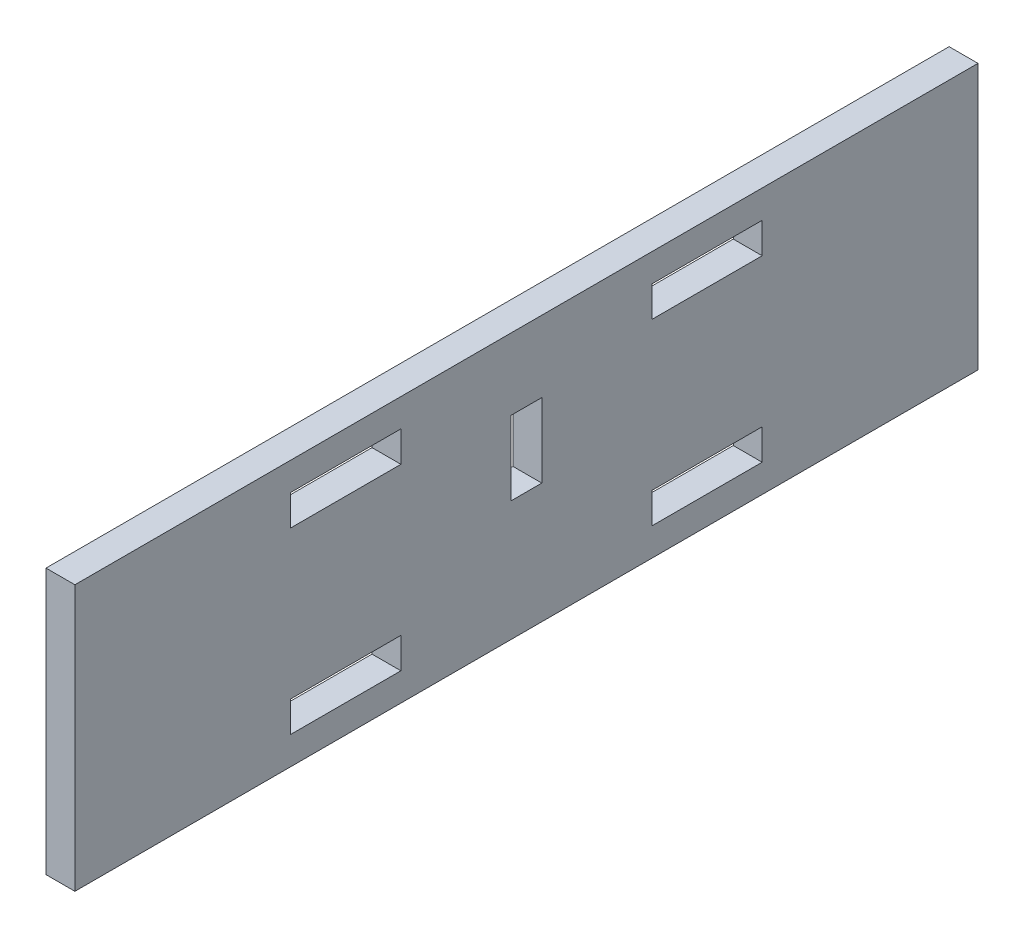
from build123d import *

# Parameters (mm, degrees)
SKETCH1_W           = 685
SKETCH1_H           = 250
BASE_FLANGE1_DEPTH  = 8
SKETCH6_W           = 60
SKETCH6_H           = 8
SKETCH6_W_2         = 70
EXTRUDE1_DEPTH      = 8
SKETCH7_W           = 250
SKETCH7_H           = 73.5
BASE_FLANGE2_DEPTH  = 8
SKETCH12_W          = 30.5
SKETCH12_H          = 8.5
EXTRUDE2_DEPTH      = 699.681794525
SKETCH14_W          = 250
SKETCH14_H          = 8
BASE_FLANGE3_DEPTH  = 50.5
SKETCH19_W          = 60
SKETCH19_H          = 8
SKETCH19_W_2        = 70
EXTRUDE3_DEPTH      = 8
BREAK_CORNER1_START = 41.5
BREAK_CORNER1_DEPTH = 8
EXTRUDE4_DEPTH      = 8
BASE_FLANGE4_DEPTH  = 8
SKETCH38_W          = 8.5
SKETCH38_H          = 20.5
EXTRUDE5_DEPTH      = 10
SKETCH39_W          = 20.5
SKETCH39_H          = 8.5
EXTRUDE6_DEPTH      = 10


# Read off the part's stored shape, not the designer's step: Break-Corner1
# Sheet-metal steps are written as plain solids
with BuildPart() as part:
    # Sketch1 → Base-Flange1 (new body)
    with BuildSketch(Plane(origin=(0, 0, 0), x_dir=(1, 0, 0), z_dir=(0, 1, 0))):
        Rectangle(SKETCH1_W, SKETCH1_H)
    extrude(amount=-BASE_FLANGE1_DEPTH)

    # Sketch6 → Extrude1 (cut)
    with BuildSketch(Plane(origin=(342.5, 0, 0), x_dir=(0, 0, -1), z_dir=(1, 0, 0))):
        with Locations((-95, -4)):
            Rectangle(SKETCH6_W, SKETCH6_H)
        with Locations((95, -4)):
            Rectangle(SKETCH6_W, SKETCH6_H)
        with Locations((0, -4)):
            Rectangle(SKETCH6_W_2, SKETCH6_H)
    extrude1 = extrude(amount=-EXTRUDE1_DEPTH, mode=Mode.SUBTRACT)

    # Mirror1: Extrude1 across plane
    add(extrude1.mirror(Plane(origin=(0, 0, 0), x_dir=(0, 0, 1), z_dir=(1, 0, 0))), mode=Mode.SUBTRACT)

    # Sketch39 → Extrude6 (cut)
    with BuildSketch(Plane.XZ.offset(8)):
        with Locations((289.5, 0)):
            Rectangle(SKETCH39_W, SKETCH39_H)
        with Locations((229.5, 0)):
            Rectangle(SKETCH39_W, SKETCH39_H)
        with Locations((-289.5, 0)):
            Rectangle(SKETCH39_W, SKETCH39_H)
        with Locations((-229.5, 0)):
            Rectangle(SKETCH39_W, SKETCH39_H)
    extrude(amount=-EXTRUDE6_DEPTH, mode=Mode.SUBTRACT)


with BuildPart() as body_2:
    # Sketch7 → Base-Flange2 (new body)
    with BuildSketch(Plane(origin=(334.5, 0, 0), x_dir=(0, 0, -1), z_dir=(1, 0, 0))):
        with Locations((0, 20.75)):
            Rectangle(SKETCH7_W, SKETCH7_H)
    extrude(amount=BASE_FLANGE2_DEPTH)

    # Sketch12 → Extrude2 (cut, through all)
    with BuildSketch(Plane(origin=(342.5, 0, 0), x_dir=(0, 0, -1), z_dir=(1, 0, 0))):
        with Locations((-50, -4)):
            Rectangle(SKETCH12_W, SKETCH12_H)
        with Locations((50, -4)):
            Rectangle(SKETCH12_W, SKETCH12_H)
        with Locations((50, 45.5)):
            Rectangle(SKETCH12_W, SKETCH12_H)
        with Locations((-50, 45.5)):
            Rectangle(SKETCH12_W, SKETCH12_H)
    extrude(amount=-EXTRUDE2_DEPTH, mode=Mode.SUBTRACT)

    # Sketch38 → Extrude5 (cut)
    with BuildSketch(Plane(origin=(342.5, 0, 0), x_dir=(0, 0, -1), z_dir=(1, 0, 0))):
        with Locations((0, 27.5)):
            Rectangle(SKETCH38_W, SKETCH38_H)
    extrude(amount=-EXTRUDE5_DEPTH, mode=Mode.SUBTRACT)


with BuildPart() as body_3:
    # Sketch14 → Base-Flange3 (new body)
    with BuildSketch(Plane.ZY.offset(-334.5)):
        with Locations((0, 45.5)):
            Rectangle(SKETCH14_W, SKETCH14_H)
    extrude(amount=-BASE_FLANGE3_DEPTH)

    # Sketch19 → Extrude3 (cut)
    with BuildSketch(Plane(origin=(342.5, 0, 0), x_dir=(0, 0, -1), z_dir=(1, 0, 0))):
        with Locations((95, 45.5)):
            Rectangle(SKETCH19_W, SKETCH19_H)
        with Locations((0, 45.5)):
            Rectangle(SKETCH19_W_2, SKETCH19_H)
        with Locations((-95, 45.5)):
            Rectangle(SKETCH19_W, SKETCH19_H)
    extrude(amount=-EXTRUDE3_DEPTH, mode=Mode.SUBTRACT)

    # Break-Corner1 outline → Break-Corner1 (cut)
    with BuildSketch(Plane(origin=(0, 0, 0), x_dir=(1, 0, 0), z_dir=(0, 1, 0)).offset(BREAK_CORNER1_START)):
        Polygon((385, -125), (385, -110), (370, -125), align=None)
        Polygon((370, 125), (385, 110), (385, 125), align=None)
    extrude(amount=BREAK_CORNER1_DEPTH, mode=Mode.SUBTRACT)

    # Sketch20 → Extrude4 (cut)
    with BuildSketch(Plane(origin=(0, 49.5, 0), x_dir=(1, 0, 0), z_dir=(0, 1, 0))):
        with BuildLine():
            Line((367, 75), (367, 55))
            ThreePointArc((367, 55), (362.5, 50.5), (358, 55))
            Line((358, 55), (358, 75))
            ThreePointArc((358, 75), (362.5, 79.5), (367, 75))
        make_face()
        with BuildLine():
            Line((367, -75), (367, -55))
            ThreePointArc((367, -55), (362.5, -50.5), (358, -55))
            Line((358, -55), (358, -75))
            ThreePointArc((358, -75), (362.5, -79.5), (367, -75))
        make_face()
    extrude(amount=-EXTRUDE4_DEPTH, mode=Mode.SUBTRACT)


with BuildPart() as body_4:
    # Mirror4: mirrored copy
    add(body_3.part.mirror(Plane(origin=(0, 0, 0), x_dir=(0, 0, 1), z_dir=(1, 0, 0))))


with BuildPart() as body_5:
    # Sketch29 → Base-Flange4 (new body)
    with BuildSketch(Plane.XY.offset(4)):
        Polygon((219.5, 0), (219.5, -8), (239.5, -8), (239.5, 0), (279.5, 0), (279.5, -8), (299.5, -8), (299.5, 0), (334.5, 0), (334.5, 17.5), (342.5, 17.5), (342.5, 37.5), (334.5, 37.5), (334.5, 57.5), (194.5, 10), (194.5, 0), align=None)
    extrude(amount=-BASE_FLANGE4_DEPTH)


with BuildPart() as body_6:
    # Mirror5: mirrored copy
    add(body_5.part.mirror(Plane(origin=(0, 0, 0), x_dir=(0, 0, 1), z_dir=(1, 0, 0))))


with BuildPart() as body_7:
    # Mirror3: mirrored copy
    add(body_2.part.mirror(Plane(origin=(0, 0, 0), x_dir=(0, 0, 1), z_dir=(1, 0, 0))))


solid = body_7.part
